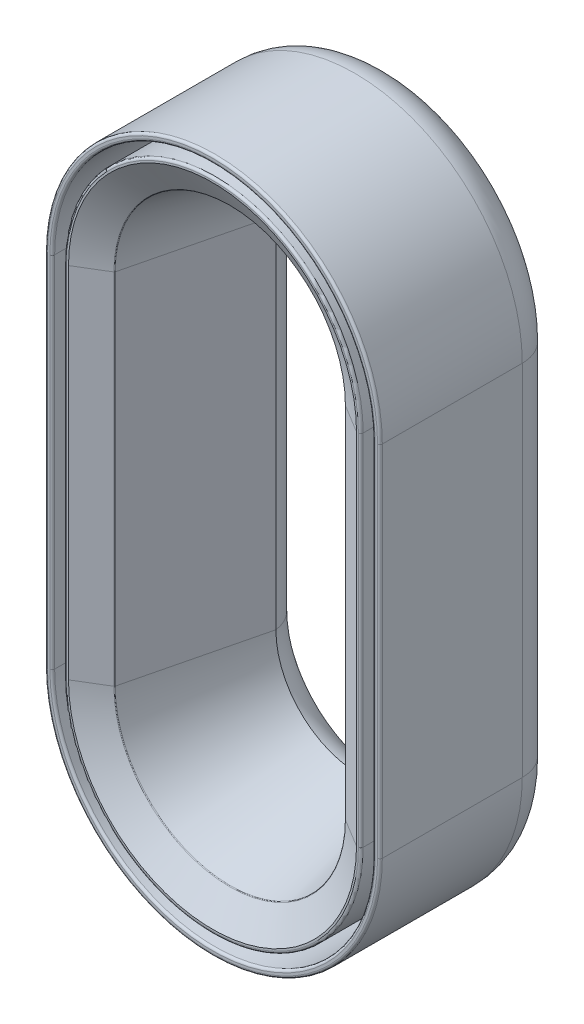
from build123d import *
from OCP.BRepFilletAPI import BRepFilletAPI_MakeChamfer

# Parameters (mm, degrees)
Y_KSEKLIK_EKSTR_ZYON1_DEPTH = 150
KES_EKSTR_ZYON1_DEPTH       = 150
PAH1_SIZE                   = 30
PAH1_SIZE2                  = 123
KES_EKSTR_ZYON2_DEPTH       = 76
KES_EKSTR_ZYON3_START       = -287
KES_EKSTR_ZYON3_DEPTH       = 10
RADYUS1_R                   = 31
RADYUS2_R                   = 2
PAH2_SIZE                   = 15
PAH2_SIZE2                  = 20.420272109
RADYUS3_R                   = 1


with BuildPart() as part:
    # Çizim1 → Yükseklik-Ekstrüzyon1 (new body)
    with BuildSketch(Plane.XY):
        with BuildLine():
            Line((-140, -150), (-140, 150))
            ThreePointArc((-140, 150), (0, 290), (140, 150))
            Line((140, 150), (140, -150))
            ThreePointArc((140, -150), (0, -290), (-140, -150))
        make_face()
    extrude(amount=Y_KSEKLIK_EKSTR_ZYON1_DEPTH)

    # Çizim2 → Kes-Ekstrüzyon1 (cut)
    with BuildSketch(Plane.XY.offset(150)):
        with BuildLine():
            Line((-70, -150), (-70, 150))
            ThreePointArc((-70, 150), (0, 220), (70, 150))
            Line((70, 150), (70, -150))
            ThreePointArc((70, -150), (0, -220), (-70, -150))
        make_face()
    extrude(amount=-KES_EKSTR_ZYON1_DEPTH, mode=Mode.SUBTRACT)

    # Pah1
    pah1_edges = [part.edges().sort_by_distance(p)[0] for p in [
        (0, -220, 150),
        (70, 0, 150),
        (0, 220, 150),
        (-70, 0, 150),
    ]]
    pah1_side = [part.faces().sort_by_distance(p)[0] for p in [
        (133.559503125, 0, 150),
    ]]
    chamfer(pah1_edges, length=PAH1_SIZE, length2=PAH1_SIZE2, reference=pah1_side[0])

    # Çizim3 → Kes-Ekstrüzyon2 (cut)
    with BuildSketch(Plane.XY.offset(150)):
        with BuildLine():
            Line((-134, 150), (-134, -150))
            ThreePointArc((-134, -150), (0, -284), (134, -150))
            Line((134, -150), (134, 150))
            ThreePointArc((134, 150), (0, 284), (-134, 150))
        make_face()
        with BuildLine():
            ThreePointArc((-124, -150), (0, -274), (124, -150))
            Line((124, -150), (124, 150))
            ThreePointArc((124, 150), (0, 274), (-124, 150))
            Line((-124, 150), (-124, -150))
        make_face(mode=Mode.SUBTRACT)
    extrude(amount=-KES_EKSTR_ZYON2_DEPTH, mode=Mode.SUBTRACT)

    # Çizim4 → Kes-Ekstrüzyon3 (cut)
    with BuildSketch(Plane(origin=(0, 0, 0), x_dir=(1, 0, 0), z_dir=(0, 1, 0)).offset(KES_EKSTR_ZYON3_START)):
        with BuildLine():
            ThreePointArc((3.756627764, -75), (2.656336966, -72.343663034), (0, -71.243372236))
            Line((0, -71.243372236), (0, -78.756627764))
            ThreePointArc((0, -78.756627764), (2.656336966, -77.656336966), (3.756627764, -75))
        make_face()
        with BuildLine():
            Line((0, -78.756627764), (0, -71.243372236))
            ThreePointArc((0, -71.243372236), (-3.756627764, -75), (0, -78.756627764))
        make_face()
    extrude(amount=-KES_EKSTR_ZYON3_DEPTH, mode=Mode.SUBTRACT)

    # Radyus1
    # the kernel refuses this fillet: 31 mm, written as the material it takes off along each edge
    with BuildSketch(Plane(origin=(0, -150, 0), x_dir=(1, 0, 0), z_dir=(0, 1, 0))) as radyus1_piece_1:
        with BuildLine():
            CenterArc((100.740852298, -31), RADYUS1_R, 90, 82.586326198)
            Line((70, -27), (69.385182954, -26.92))
            ThreePointArc((69.385182954, -26.92), (69.38, -13.5), (69.38, 0))
            Line((69.38, 0), (70, 0.62))
            Line((70, 0.62), (100.740852298, 0.62))
            Line((100.740852298, 0.62), (100.740852298, 0))
        make_face()
    revolve(axis=Axis((0, -150, 0), (0, 0, -1)), revolution_arc=180, mode=Mode.SUBTRACT)
    with BuildSketch(Plane(origin=(-70, -150, 0), x_dir=(-1, 0, 0), z_dir=(0, 1, 0)), Plane(origin=(70, 150, 0), x_dir=(1, 0, 0), z_dir=(0, -1, 0))) as radyus1_piece_2:
        with BuildLine():
            CenterArc((30.740852298, 31), RADYUS1_R, 187.413673802, 82.586326198)
            Line((0, 27), (-0.614817046, 26.92))
            ThreePointArc((-0.614817046, 26.92), (-0.62, 13.5), (-0.62, 0))
            Line((-0.62, 0), (0, -0.62))
            Line((0, -0.62), (30.740852298, -0.62))
            Line((30.740852298, -0.62), (30.740852298, 0))
        make_face()
    extrude(amount=300, mode=Mode.SUBTRACT)
    with BuildSketch(Plane(origin=(0, 150, 0), x_dir=(-1, 0, 0), z_dir=(0, -1, 0))) as radyus1_piece_3:
        with BuildLine():
            CenterArc((100.740852298, -31), RADYUS1_R, 90, 82.586326198)
            Line((70, -27), (69.385182954, -26.92))
            ThreePointArc((69.385182954, -26.92), (69.38, -13.5), (69.38, 0))
            Line((69.38, 0), (70, 0.62))
            Line((70, 0.62), (100.740852298, 0.62))
            Line((100.740852298, 0.62), (100.740852298, 0))
        make_face()
    revolve(axis=Axis((0, 150, 0), (0, 0, -1)), revolution_arc=180, mode=Mode.SUBTRACT)
    with BuildSketch(Plane(origin=(0, 150, 0), x_dir=(-1, 0, 0), z_dir=(0, -1, 0))) as radyus1_piece_4:
        with BuildLine():
            CenterArc((140 - RADYUS1_R, -RADYUS1_R), RADYUS1_R, 0, 90)
            Line((140 - RADYUS1_R, 0), (140 - RADYUS1_R, RADYUS1_R * 0.02))
            Line((140 - RADYUS1_R, RADYUS1_R * 0.02), (140 + RADYUS1_R * 0.02, RADYUS1_R * 0.02))
            Line((140 + RADYUS1_R * 0.02, RADYUS1_R * 0.02), (140 + RADYUS1_R * 0.02, -RADYUS1_R))
            Line((140 + RADYUS1_R * 0.02, -RADYUS1_R), (140, -RADYUS1_R))
        make_face()
    revolve(axis=Axis((0, 150, 0), (0, 0, -1)), revolution_arc=180, mode=Mode.SUBTRACT)
    with BuildSketch(Plane(origin=(140, 150, 0), x_dir=(0, 0, 1), z_dir=(0, -1, 0)), Plane(origin=(-140, -150, 0), x_dir=(0, 0, 1), z_dir=(0, 1, 0))) as radyus1_piece_5:
        with BuildLine():
            CenterArc((RADYUS1_R, RADYUS1_R), RADYUS1_R, 180, 90)
            Line((0, RADYUS1_R), (-RADYUS1_R * 0.02, RADYUS1_R))
            Line((-RADYUS1_R * 0.02, RADYUS1_R), (-RADYUS1_R * 0.02, -RADYUS1_R * 0.02))
            Line((-RADYUS1_R * 0.02, -RADYUS1_R * 0.02), (RADYUS1_R, -RADYUS1_R * 0.02))
            Line((RADYUS1_R, -RADYUS1_R * 0.02), (RADYUS1_R, 0))
        make_face()
    extrude(amount=300, mode=Mode.SUBTRACT)
    with BuildSketch(Plane(origin=(0, -150, 0), x_dir=(1, 0, 0), z_dir=(0, 1, 0))) as radyus1_piece_6:
        with BuildLine():
            CenterArc((140 - RADYUS1_R, -RADYUS1_R), RADYUS1_R, 0, 90)
            Line((140 - RADYUS1_R, 0), (140 - RADYUS1_R, RADYUS1_R * 0.02))
            Line((140 - RADYUS1_R, RADYUS1_R * 0.02), (140 + RADYUS1_R * 0.02, RADYUS1_R * 0.02))
            Line((140 + RADYUS1_R * 0.02, RADYUS1_R * 0.02), (140 + RADYUS1_R * 0.02, -RADYUS1_R))
            Line((140 + RADYUS1_R * 0.02, -RADYUS1_R), (140, -RADYUS1_R))
        make_face()
    revolve(axis=Axis((0, -150, 0), (0, 0, -1)), revolution_arc=180, mode=Mode.SUBTRACT)

    # Radyus2
    radyus2_edges = [part.edges().sort_by_distance(p)[0] for p in [
        (0, 290, 150),
        (-140, 0, 150),
        (0, -290, 150),
        (0, -274, 150),
        (124, 0, 150),
        (0, 274, 150),
        (-124, 0, 150),
        (-134, 0, 150),
        (0, -284, 150),
        (134, 0, 150),
        (0, 284, 150),
        (140, 0, 150),
    ]]
    fillet(radyus2_edges, radius=RADYUS2_R)

    # Pah2: one chamfer whose edges measure the first distance from different faces: ONE call of the kernel's chamfer builder (chamfer() names one face for all edges)
    pah2_edges_1 = [part.edges().sort_by_distance(p)[0] for p in [
        (100, 0, 150),
    ]]
    pah2_side_1 = [part.faces().sort_by_distance(p)[0] for p in [
        (85, 0, 88.5),
    ]]
    pah2_edges_2 = [part.edges().sort_by_distance(p)[0] for p in [
        (0, 250, 150),
    ]]
    pah2_side_2 = [part.faces().sort_by_distance(p)[0] for p in [
        (0, 235, 88.5),
    ]]
    pah2_edges_3 = [part.edges().sort_by_distance(p)[0] for p in [
        (0, -250, 150),
    ]]
    pah2_side_3 = [part.faces().sort_by_distance(p)[0] for p in [
        (0, -235, 88.5),
    ]]
    pah2_edges_4 = [part.edges().sort_by_distance(p)[0] for p in [
        (-100, 0, 150),
    ]]
    pah2_side_4 = [part.faces().sort_by_distance(p)[0] for p in [
        (-85, 0, 88.5),
    ]]
    pah2 = BRepFilletAPI_MakeChamfer(part.part.solid().wrapped)
    for e in pah2_edges_1:
        pah2.Add(PAH2_SIZE, PAH2_SIZE2, e.wrapped, pah2_side_1[0].wrapped)  # the first distance lies on this face
    for e in pah2_edges_2:
        pah2.Add(PAH2_SIZE, PAH2_SIZE2, e.wrapped, pah2_side_2[0].wrapped)  # the first distance lies on this face
    for e in pah2_edges_3:
        pah2.Add(PAH2_SIZE, PAH2_SIZE2, e.wrapped, pah2_side_3[0].wrapped)  # the first distance lies on this face
    for e in pah2_edges_4:
        pah2.Add(PAH2_SIZE, PAH2_SIZE2, e.wrapped, pah2_side_4[0].wrapped)  # the first distance lies on this face
    add(Compound.cast(pah2.Shape()), mode=Mode.REPLACE)

    # Radyus3
    radyus3_edges = [part.edges().sort_by_distance(p)[0] for p in [
        (96.445657297, 0, 135.427194918),
        (0, -246.445657297, 135.427194918),
        (0, 246.445657297, 135.427194918),
        (-96.445657297, 0, 135.427194918),
    ]]
    fillet(radyus3_edges, radius=RADYUS3_R)


solid = part.part
